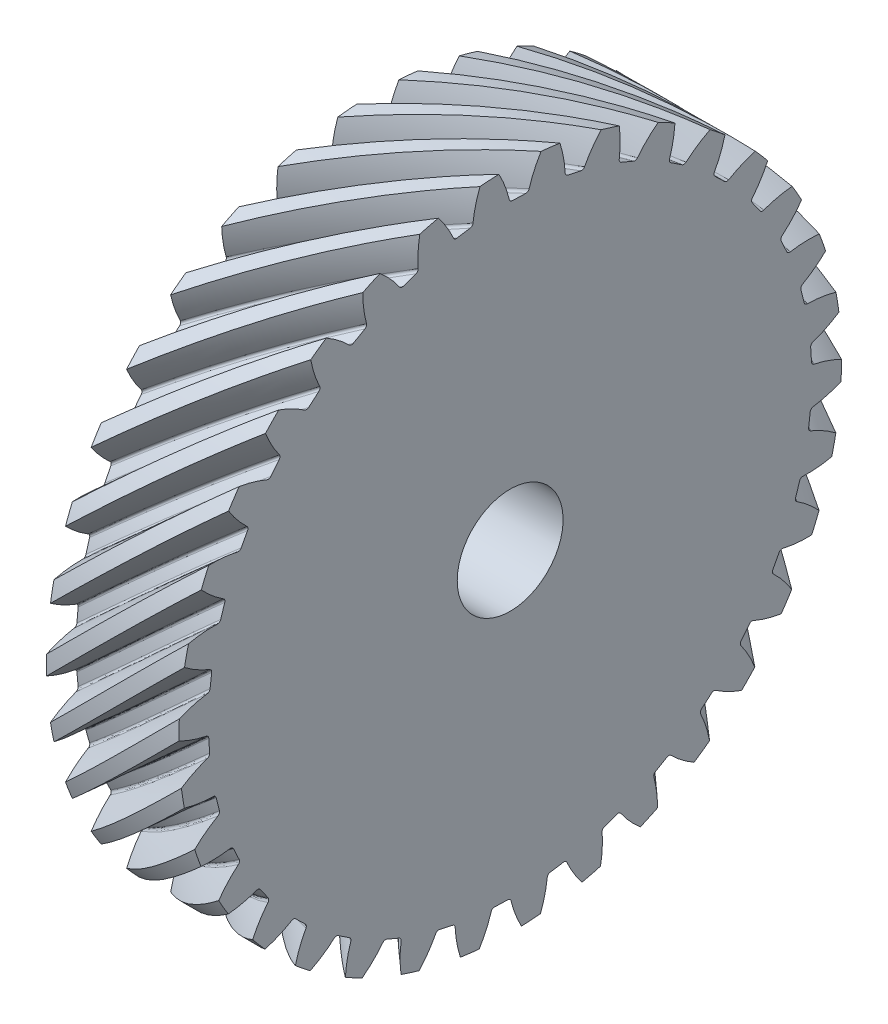
from build123d import *

# Parameters (mm, degrees)
BASPROSKE_W            = 25
BASPROSKE_H            = 62.604076401
TOOTHCUTLH_PITCH       = 393.353013011
TOOTHCUTLH_HEIGHT      = 25
TOOTHCUTLH_RADIUS      = 62.604076401
TOOTHCUTLH_START_ANGLE = -90
TEETHCUTSLH_COUNT      = 34
TEETHCUTSLH_ANGLE      = 349.411764706
BORSKE_R               = 10
BORE_DEPTH             = 62.5000025


with BuildPart() as part:
    # BasProSke → Base-Revolve (revolve)
    with BuildSketch(Plane(origin=(0, 0, 0), x_dir=(1, 0, 0), z_dir=(0, 1, 0)), mode=Mode.PRIVATE) as base_revolve_sk:
        with Locations((12.5, 31.302038201)):
            Rectangle(BASPROSKE_W, BASPROSKE_H)
    revolve(base_revolve_sk.sketch.rotate(Axis((-10, 0, 0), (1, 0, 0)), 180), axis=Axis((-10, 0, 0), (1, 0, 0)))

    # ToothCutLH: sweep along a helix
    with BuildLine() as toothcutlh_path:
        add(Helix(TOOTHCUTLH_PITCH, TOOTHCUTLH_HEIGHT, TOOTHCUTLH_RADIUS, center=(0, 0, 0), direction=(1, 0, 0), lefthand=True, mode=Mode.PRIVATE).rotate(Axis((0, 0, 0), (1, 0, 0)), TOOTHCUTLH_START_ANGLE))
    # TooCutSkeRH<3> → ToothCutLH (sweep, cut)
    with BuildSketch(Plane(origin=(0, 0, 0), x_dir=(0, 0, -1), z_dir=(1, 0, 0))):
        with BuildLine():
            ThreePointArc((1.256378353, 56.965223259), (0, 56.979076401), (-1.256378353, 56.965223259))
            ThreePointArc((-1.256378353, 56.965223259), (-1.644522932, 57.089329572), (-1.874039261, 57.426050296))
            ThreePointArc((-1.874039261, 57.426050296), (-3.204893121, 60.998674179), (-5.152707424, 64.275995165))
            ThreePointArc((-5.152707424, 64.275995165), (0, 64.482198693), (5.152707424, 64.275995165))
            ThreePointArc((5.152707424, 64.275995165), (3.204893121, 60.998674179), (1.874039261, 57.426050296))
            ThreePointArc((1.874039261, 57.426050296), (1.644522932, 57.089329572), (1.256378353, 56.965223259))
        make_face()
    toothcutlh = sweep(path=toothcutlh_path.line, is_frenet=True, mode=Mode.SUBTRACT)

    # TeethCutsLH: ToothCutLH ×34 about axis
    teethcutslh_axis = Axis((-10, 0, 0), (1, 0, 0))
    for i in range(1, TEETHCUTSLH_COUNT):
        add(toothcutlh.rotate(teethcutslh_axis, i * TEETHCUTSLH_ANGLE / (TEETHCUTSLH_COUNT - 1)), mode=Mode.SUBTRACT)

    # BorSke → Bore (cut, symmetric)
    with BuildSketch(Plane(origin=(0, 0, 0), x_dir=(0, 0, -1), z_dir=(1, 0, 0))):
        with Locations(Location((0, 0, 0), (0, 0, 180))):
            Circle(BORSKE_R)
    extrude(amount=BORE_DEPTH, both=True, mode=Mode.SUBTRACT)


solid = part.part
